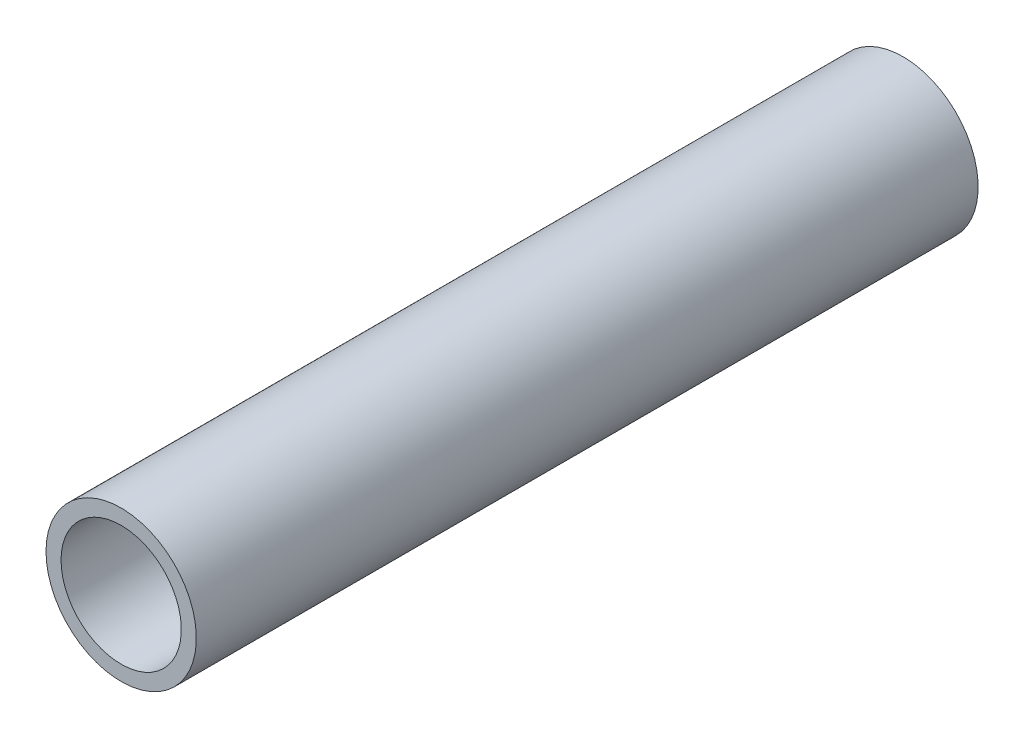
from build123d import *

# Parameters (mm, degrees)
SKETCH1_R           = 1.25
SKETCH1_R_2         = 1
BOSS_EXTRUDE1_DEPTH = 13


with BuildPart() as part:
    # Sketch1 → Boss-Extrude1 (new body)
    with BuildSketch(Plane.XY):
        Circle(SKETCH1_R)
        Circle(SKETCH1_R_2, mode=Mode.SUBTRACT)
    extrude(amount=BOSS_EXTRUDE1_DEPTH)


solid = part.part
